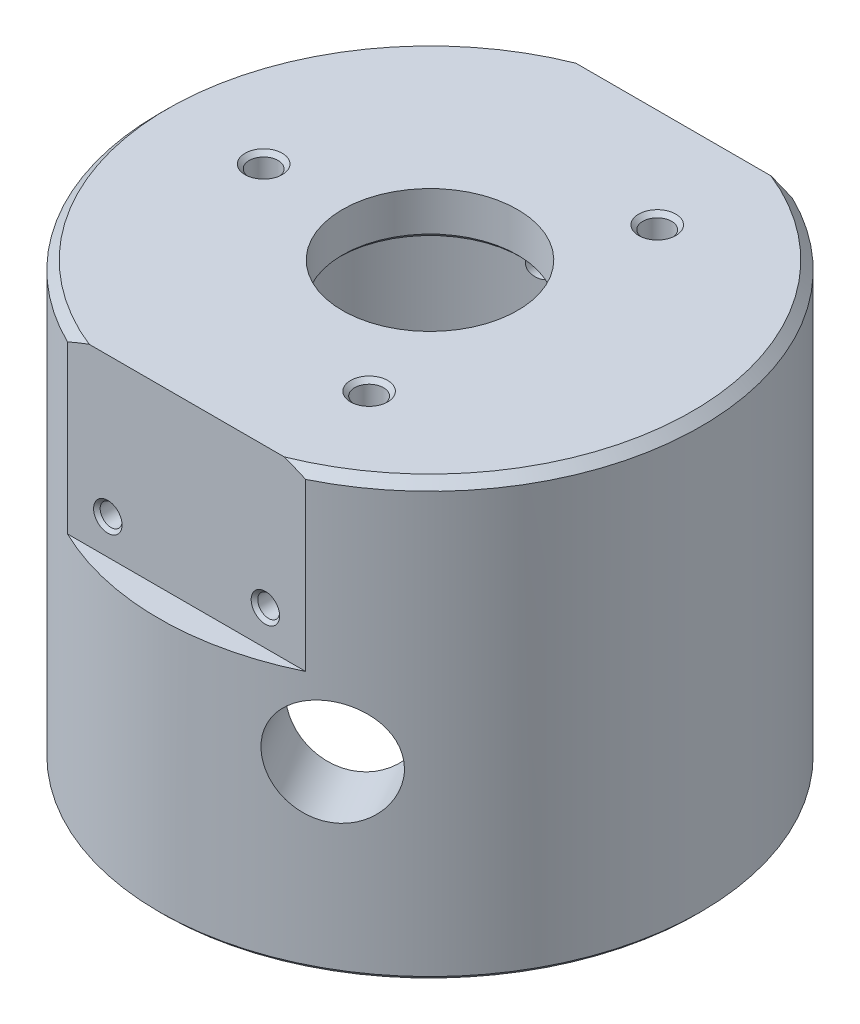
from build123d import *

# Parameters (mm, degrees)
CHANFREIN1_SIZE                           = 0.5
ENL_V_MAT_EXTRU_10_REACH                  = 97.805
ENL_V_MAT_EXTRU_10_END_RADIUS             = 23.5
ESQUISSE29_R                              = 6
R_P_TITION_CIRCULAIRE1_COUNT              = 3
CHANFREIN3_SIZE                           = 1
ESQUISSE12_W                              = 27.20753572
ESQUISSE12_H                              = 7
ENL_V_MAT_EXTRU_5_DEPTH                   = 20
TROU_TARAUD_M3X0_51_D                     = 2.5
TROU_TARAUD_M3X0_51_DEPTH                 = 10
TROU_TARAUD_M3X0_51_CSINK_D               = 3.25
TROU_TARAUD_M3X0_51_CSINK_ANGLE           = 90
TROU_TARAUD_M3X0_51_TIP                   = 0.751075774
TROU_TARAUD_M4X0_71_D                     = 3.3
TROU_TARAUD_M4X0_71_CSINK_D               = 4.25
TROU_TARAUD_M4X0_71_CSINK_ANGLE           = 90
TROU_TARAUD_M3X0_52_D                     = 2.5
TROU_TARAUD_M3X0_52_CSINK_D               = 3.25
TROU_TARAUD_M3X0_52_CSINK_ANGLE           = 90
TROU_TARAUD_M3X0_52_ON_FACE_2_D           = 2.5
TROU_TARAUD_M3X0_52_ON_FACE_2_CSINK_D     = 3.25
TROU_TARAUD_M3X0_52_ON_FACE_2_CSINK_ANGLE = 90
TROU_TARAUD_M6X1_01_D                     = 5
TROU_TARAUD_M6X1_01_CSINK_D               = 6.2
TROU_TARAUD_M6X1_01_CSINK_ANGLE           = 90


# Read off the part's stored shape, not the designer's step: Trou taraudé M4x0.72
with BuildPart() as part:
    # Esquisse1 → Révolution1 (revolve)
    with BuildSketch(Plane.XY, mode=Mode.PRIVATE) as r_volution1_sk:
        Polygon((30.95, -16.75), (30.95, -66.25), (23.5, -66.25), (23.5, -23.75), (19.5, -23.75), (19.5, -21.75), (10, -21.75), (10, -16.75), align=None)
    revolve(r_volution1_sk.sketch.rotate(Axis((0, 0, 0), (0, -1, 0)), 180), axis=Axis((0, 0, 0), (0, -1, 0)))

    # Chanfrein1
    chanfrein1_edges = [part.edges().sort_by_distance(p)[0] for p in [
        (10, -21.75, 0),
        (19.5, -23.75, 0),
        (23.5, -66.25, 0),
        (30.95, -66.25, 0),
    ]]
    chamfer(chanfrein1_edges, length=CHANFREIN1_SIZE)

    # Enlèv. mat.-Extru.10: up to this cylinder (the profile starts outside it)
    enl_v_mat_extru_10_end = Plane(origin=(0, -45.25, 0), z_dir=(0, 1, 0)) * Cylinder(ENL_V_MAT_EXTRU_10_END_RADIUS, 243.61, mode=Mode.PRIVATE)
    # Esquisse29 → Enlèv. mat.-Extru.10 (cut, up to the surface)
    with BuildSketch(Plane.ZY.offset(30.95), mode=Mode.PRIVATE) as enl_v_mat_extru_10_sk1:
        with Locations(Location((0, -45.25, 0), (0, 0, 270))):
            Circle(ESQUISSE29_R)
    enl_v_mat_extru_10_tool1 = extrude(enl_v_mat_extru_10_sk1.sketch, amount=-ENL_V_MAT_EXTRU_10_REACH, mode=Mode.PRIVATE) - enl_v_mat_extru_10_end
    enl_v_mat_extru_10 = enl_v_mat_extru_10_tool1.solids().sort_by_distance((-30.95, -45.25, 0))[0]
    add(enl_v_mat_extru_10, mode=Mode.SUBTRACT)

    # Répétition circulaire1: Enlèv. mat.-Extru.10 ×3 about axis
    r_p_tition_circulaire1_axis = Axis((0, 0, 0), (0, 1, 0))
    for i in range(1, R_P_TITION_CIRCULAIRE1_COUNT):
        add(enl_v_mat_extru_10.rotate(r_p_tition_circulaire1_axis, i * 360 / R_P_TITION_CIRCULAIRE1_COUNT), mode=Mode.SUBTRACT)

    # Chanfrein3
    chanfrein3_edges = [part.edges().sort_by_distance(p)[0] for p in [
        (30.95, -16.75, 0),
    ]]
    chamfer(chanfrein3_edges, length=CHANFREIN3_SIZE)

    # Esquisse12 → Enlèv. mat.-Extru.5 (cut)
    with BuildSketch(Plane(origin=(0, -16.75, 0), x_dir=(1, 0, 0), z_dir=(0, 1, 0))):
        with Locations((0, 31.3)):
            Rectangle(ESQUISSE12_W, ESQUISSE12_H)
        with Locations((0, -31.3)):
            Rectangle(ESQUISSE12_W, ESQUISSE12_H)
    extrude(amount=-ENL_V_MAT_EXTRU_5_DEPTH, mode=Mode.SUBTRACT)

    # Trou taraudé M3x0.51
    with Locations(Plane(origin=(-13.625, -66.25, -23.599192253), x_dir=(-1, 0, 0), z_dir=(0, -1, 0))):
        with Locations((0, 0), (13.625, -23.599192253), (0, -47.198384506), (-27.25, -47.198384506), (-40.875, -23.599192253), (-27.25, 0)):
            CounterSinkHole(TROU_TARAUD_M3X0_51_D / 2, TROU_TARAUD_M3X0_51_CSINK_D / 2, depth=TROU_TARAUD_M3X0_51_DEPTH, counter_sink_angle=TROU_TARAUD_M3X0_51_CSINK_ANGLE)
            with Locations((0, 0, -(TROU_TARAUD_M3X0_51_DEPTH + TROU_TARAUD_M3X0_51_TIP / 2))):  # 118° drill point
                Cone(0, TROU_TARAUD_M3X0_51_D / 2, TROU_TARAUD_M3X0_51_TIP, mode=Mode.SUBTRACT)

    # Trou taraudé M4x0.71 (through all)
    with Locations(Plane(origin=(9.5, -16.75, 16.454482672), x_dir=(1, 0, 0), z_dir=(0, 1, 0))):
        with Locations((0, 0), (-28.5, 16.454482672), (0, 32.908965344)):
            CounterSinkHole(TROU_TARAUD_M4X0_71_D / 2, TROU_TARAUD_M4X0_71_CSINK_D / 2, counter_sink_angle=TROU_TARAUD_M4X0_71_CSINK_ANGLE)

    # Trou taraudé M3x0.52 (through all)
    with Locations(Plane(origin=(9, -32.75, -27.8), x_dir=(-1, 0, 0), z_dir=(0, 0, -1))):
        with Locations((0, 0), (18, 0)):
            CounterSinkHole(TROU_TARAUD_M3X0_52_D / 2, TROU_TARAUD_M3X0_52_CSINK_D / 2, counter_sink_angle=TROU_TARAUD_M3X0_52_CSINK_ANGLE)

    # Trou taraudé M3x0.52 on face 2 (through all)
    with Locations(Plane(origin=(-9, -32.75, 27.8), x_dir=(1, 0, 0), z_dir=(0, 0, 1))):
        with Locations((0, 0), (18, 0)):
            CounterSinkHole(TROU_TARAUD_M3X0_52_ON_FACE_2_D / 2, TROU_TARAUD_M3X0_52_ON_FACE_2_CSINK_D / 2, counter_sink_angle=TROU_TARAUD_M3X0_52_ON_FACE_2_CSINK_ANGLE)

    # Trou taraudé M4x0.72 outline → Trou taraudé M4x0.72 (revolve, cut)
    with BuildSketch(Plane(origin=(0, -56.757814183, 0), x_dir=(0.5002028177394721, 0, -0.8659082752379104), z_dir=(0, -1, 0))):
        Polygon((0, -30.950033867), (2.125033867, -30.950033867), (1.65, -30.475), (1.65, -23.44197165), (0, -23.44197165), align=None)
    revolve(axis=Axis((0, -56.757814183, 0), (0.8659082752379106, 0, 0.5002028177394722)), mode=Mode.SUBTRACT)

    # Trou taraud_ M4x0.72 2 outline → Trou taraud_ M4x0.72 2 (revolve, cut)
    with BuildSketch(Plane(origin=(0, -29.773284315, 0), x_dir=(0.5006999763927381, 0, -0.8656208948727563), z_dir=(0, -1, 0))):
        Polygon((0, -30.950033494), (2.125033494, -30.950033494), (1.65, -30.475), (1.65, -23.44197165), (0, -23.44197165), align=None)
    revolve(axis=Axis((0, -29.773284315, 0), (0.8656208948727563, 0, 0.5006999763927381)), mode=Mode.SUBTRACT)

    # Trou taraudé M6x1.01 (through all)
    with Locations(Plane(origin=(-15.475, -45.25, -26.803486247), x_dir=(-0.866025403784, 0, 0.5), z_dir=(-0.5, 0, -0.866025403784))):
        with Locations((0, 0)):
            CounterSinkHole(TROU_TARAUD_M6X1_01_D / 2, TROU_TARAUD_M6X1_01_CSINK_D / 2, counter_sink_angle=TROU_TARAUD_M6X1_01_CSINK_ANGLE)


solid = part.part
